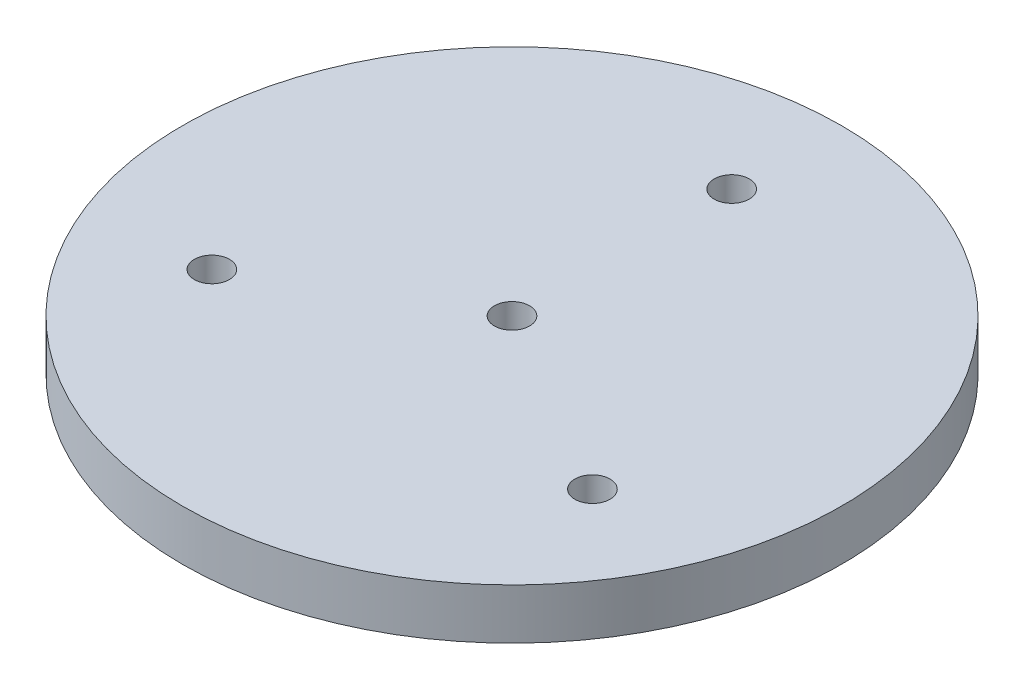
from build123d import *

# Parameters (mm, degrees)
SKETCH1_R           = 75
BOSS_EXTRUDE1_DEPTH = 11.482
SKETCH2_R           = 4
CUT_EXTRUDE1_DEPTH  = 107.685689406
CIRPATTERN1_COUNT   = 3
SKETCH3_R           = 4
CUT_EXTRUDE2_DEPTH  = 107.685689406


with BuildPart() as part:
    # Sketch1 → Boss-Extrude1 (new body)
    with BuildSketch(Plane(origin=(0, 0, 0), x_dir=(1, 0, 0), z_dir=(0, 1, 0))):
        Circle(SKETCH1_R)
    extrude(amount=BOSS_EXTRUDE1_DEPTH)

    # Sketch2 → Cut-Extrude1 (cut, through all)
    with BuildSketch(Plane(origin=(0, 11.482, 0), x_dir=(1, 0, 0), z_dir=(0, 1, 0))):
        with Locations((0, 50)):
            Circle(SKETCH2_R)
    cut_extrude1 = extrude(amount=-CUT_EXTRUDE1_DEPTH, mode=Mode.SUBTRACT)

    # CirPattern1: Cut-Extrude1 ×3 about axis
    cirpattern1_axis = Axis((0, 12.0561, 0), (0, -1, 0))
    for i in range(1, CIRPATTERN1_COUNT):
        add(cut_extrude1.rotate(cirpattern1_axis, i * 360 / CIRPATTERN1_COUNT), mode=Mode.SUBTRACT)

    # Sketch3 → Cut-Extrude2 (cut, through all)
    with BuildSketch(Plane(origin=(0, 11.482, 0), x_dir=(1, 0, 0), z_dir=(0, 1, 0))):
        Circle(SKETCH3_R)
    extrude(amount=-CUT_EXTRUDE2_DEPTH, mode=Mode.SUBTRACT)


solid = part.part
